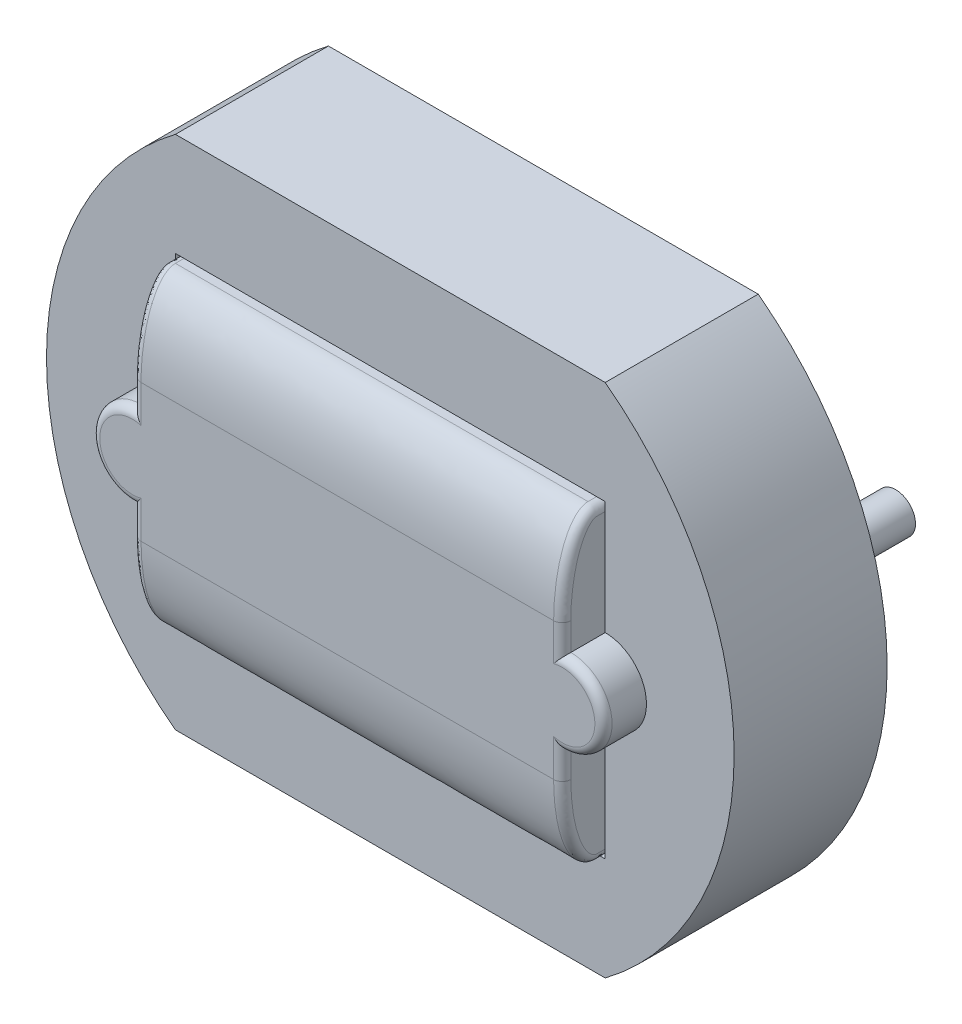
from build123d import *

# Parameters (mm, degrees)
BOSS_EXTRUDE1_DEPTH      = 1.78
SKETCH2_R                = 0.23
BOSS_EXTRUDE2_DEPTH      = 1.6
BOSS_EXTRUDE2_2_DEPTH    = 1.6
CUT_EXTRUDE1_DEPTH       = 0.75
SKETCH4_R                = 0.23
CUT_EXTRUDE2_DEPTH       = 1.03
SKETCH5_R                = 0.23
BOSS_EXTRUDE3_DEPTH      = 1.28
BOSS_EXTRUDE3_2_DEPTH    = 1.28
SKETCH6_W                = 2.27
SKETCH6_H                = 2.27
BOSS_EXTRUDE4_DEPTH      = 0.25
BOSS_EXTRUDE6_DEPTH      = 0.5
BOSS_EXTRUDE6_DEPTH_BACK = 0.75
FILLET1_SIZE             = 0.4
FILLET1_SIZE_2           = 1
FILLET2_R                = 0.1


with BuildPart() as part:
    # Sketch1 → Boss-Extrude1 (new body)
    with BuildSketch(Plane.XY):
        with BuildLine():
            Line((-2.5, -3), (2.5, -3))
            ThreePointArc((2.5, -3), (4, 0), (2.5, 3))
            Line((2.5, 3), (-2.5, 3))
            ThreePointArc((-2.5, 3), (-4, 0), (-2.5, -3))
        make_face()
    extrude(amount=BOSS_EXTRUDE1_DEPTH)

    # Sketch3 → Cut-Extrude1 (cut)
    with BuildSketch(Plane.XY.offset(1.78)):
        with BuildLine():
            Line((-2.5, 1.8), (-2.5, 0.48))
            ThreePointArc((-2.5, 0.48), (-2.98, 0), (-2.5, -0.48))
            Line((-2.5, -0.48), (-2.5, -1.8))
            Line((-2.5, -1.8), (2.5, -1.8))
            Line((2.5, -1.8), (2.5, -0.48))
            ThreePointArc((2.5, -0.48), (2.98, 0), (2.5, 0.48))
            Line((2.5, 0.48), (2.5, 1.8))
            Line((2.5, 1.8), (-2.5, 1.8))
        make_face()
    extrude(amount=-CUT_EXTRUDE1_DEPTH, mode=Mode.SUBTRACT)

    # Sketch4 → Cut-Extrude2 (cut)
    with BuildSketch(Plane.XY.offset(1.03)):
        with Locations((-2.5, 0)):
            Circle(SKETCH4_R)
        with Locations((2.5, 0)):
            Circle(SKETCH4_R)
    extrude(amount=-CUT_EXTRUDE2_DEPTH, mode=Mode.SUBTRACT)


with BuildPart() as body_2:
    # Sketch2 → Boss-Extrude2 (new body)
    with BuildSketch(Plane(origin=(0, 0, 0), x_dir=(-1, 0, 0), z_dir=(0, 0, -1))):
        with Locations((-2.5, 0)):
            Circle(SKETCH2_R)
    extrude(amount=BOSS_EXTRUDE2_DEPTH)


with BuildPart() as body_3:
    # Sketch2 → Boss-Extrude2 2 (new body)
    with BuildSketch(Plane(origin=(0, 0, 0), x_dir=(-1, 0, 0), z_dir=(0, 0, -1))):
        with Locations((2.5, 0)):
            Circle(SKETCH2_R)
    extrude(amount=BOSS_EXTRUDE2_2_DEPTH)


with BuildPart() as body_4:
    # Sketch5 → Boss-Extrude3 (new body)
    with BuildSketch(Plane.XY):
        with Locations((2.5, 0)):
            Circle(SKETCH5_R)
    extrude(amount=BOSS_EXTRUDE3_DEPTH)

    # Combine1: union body 2
    add(body_2.part)


with BuildPart() as body_5:
    # Sketch5 → Boss-Extrude3 2 (new body)
    with BuildSketch(Plane.XY):
        with Locations((-2.5, 0)):
            Circle(SKETCH5_R)
    extrude(amount=BOSS_EXTRUDE3_2_DEPTH)


with BuildPart() as body_6:
    # Sketch6 → Boss-Extrude4 (new body)
    with BuildSketch(Plane.XY.offset(1.03)):
        Rectangle(SKETCH6_W, SKETCH6_H)
    extrude(amount=BOSS_EXTRUDE4_DEPTH)


with BuildPart() as body_3_1:
    add(body_3.part)

    # Combine2: union body 5
    add(body_5.part)


with BuildPart() as body_5_2:
    # Sketch7 → Boss-Extrude6 (new, two sides: drawn at the far end of the back side and taken through both)
    with BuildSketch(Plane.XY.offset(1.78).offset(-BOSS_EXTRUDE6_DEPTH_BACK)):
        with BuildLine():
            Line((2.5, 0.48), (2.5, 1.8))
            Line((2.5, 1.8), (-2.5, 1.8))
            Line((-2.5, 1.8), (-2.5, 0.48))
            ThreePointArc((-2.5, 0.48), (-2.98, 0), (-2.5, -0.48))
            Line((-2.5, -0.48), (-2.5, -1.8))
            Line((-2.5, -1.8), (2.5, -1.8))
            Line((2.5, -1.8), (2.5, -0.48))
            ThreePointArc((2.5, -0.48), (2.98, 0), (2.5, 0.48))
        make_face()
    extrude(amount=BOSS_EXTRUDE6_DEPTH + BOSS_EXTRUDE6_DEPTH_BACK)

    # Fillet1
    # an asymmetric fillet: 1, 0.4 mm, written as the material it takes off along each edge
    with BuildSketch(Plane(origin=(5, 1.8, 2.28), x_dir=(0, 0, -1), z_dir=(-1, 0, 0)), Plane(origin=(-5, -1.8, 2.28), x_dir=(0, 0, -1), z_dir=(1, 0, 0))) as fillet1_piece_1:
        with BuildLine():
            Bezier((FILLET1_SIZE, 0), (0, 0), (0, FILLET1_SIZE_2), weights=[1, 0.707106781, 1])
            Line((0, FILLET1_SIZE_2), (0, 0))
            Line((0, 0), (FILLET1_SIZE, 0))
        make_face()
    extrude(amount=10, mode=Mode.SUBTRACT)

    # Fillet2
    fillet2_edges = [body_5_2.edges().sort_by_distance(p)[0] for p in [
        (-2.5, -1.36922048, 2.208873973),
        (-2.5, -0.64, 2.28),
        (-2.5, 1.36922048, 2.208873973),
        (-2.5, 0.64, 2.28),
        (-2.98, 0, 2.28),
        (2.5, 0.64, 2.28),
        (2.5, 1.36922048, 2.208873973),
        (2.98, 0, 2.28),
        (2.5, -1.36922048, 2.208873973),
        (2.5, -0.64, 2.28),
    ]]
    fillet(fillet2_edges, radius=FILLET2_R)


solid = Compound([part.part, body_4.part, body_6.part, body_3_1.part, body_5_2.part])
